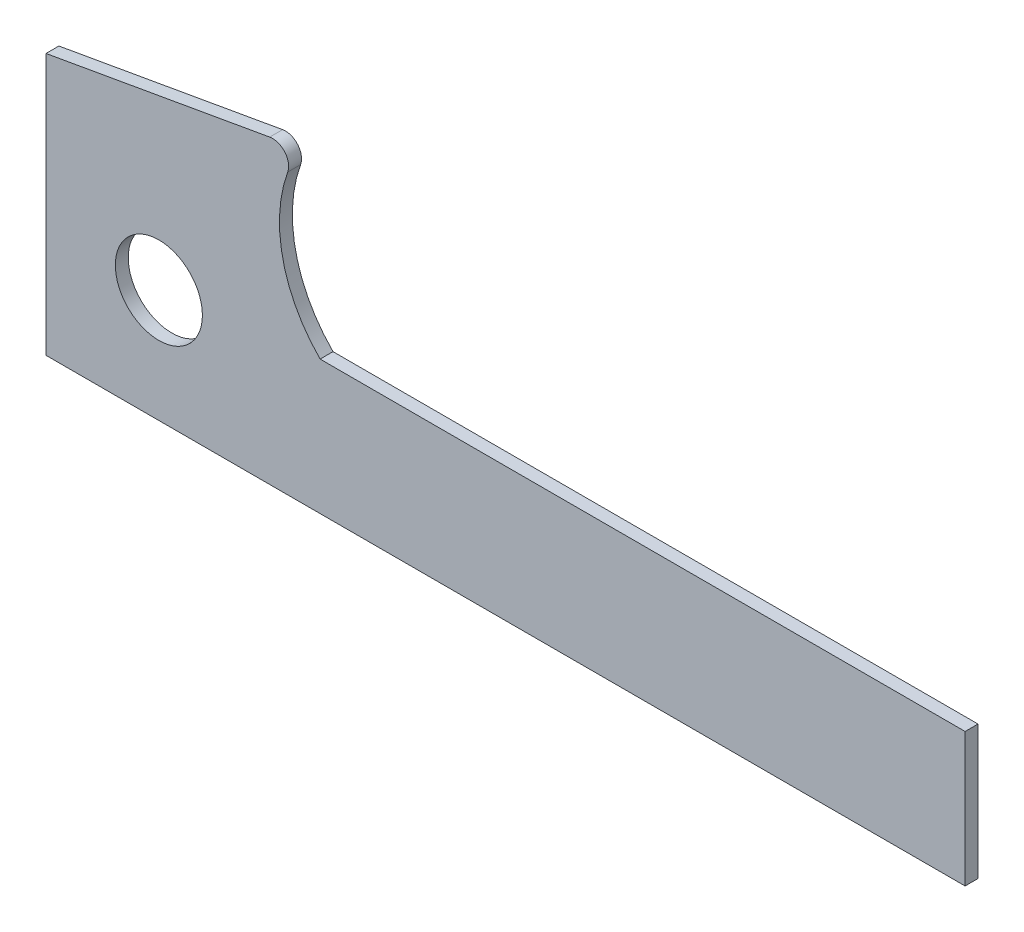
from build123d import *

# Parameters (mm, degrees)
SKETCH_1_R             = 13.5
SM_BASE_FLANGE_1_DEPTH = 4


# Sheet-metal steps are written as plain solids
with BuildPart() as part:
    # Sketch 1 → Базовая кромка1 (new body)
    with BuildSketch(Plane.XY):
        with BuildLine():
            Line((0, -35), (250, -35))
            Line((250, -35), (250, 6.5))
            Line((250, 6.5), (50, 6.5))
            ThreePointArc((50, 6.5), (38.424329978, 27.637073819), (39.947947324, 51.688074136))
            ThreePointArc((39.947947324, 51.688074136), (39.067621468, 56.60193476), (34.375031444, 58.305049172))
            Line((34.375031444, 58.305049172), (-35, 46.072359341))
            Line((-35, 46.072359341), (-35, -35))
            Line((-35, -35), (0, -35))
        make_face()
        Circle(SKETCH_1_R, mode=Mode.SUBTRACT)
    extrude(amount=-SM_BASE_FLANGE_1_DEPTH)


solid = part.part
